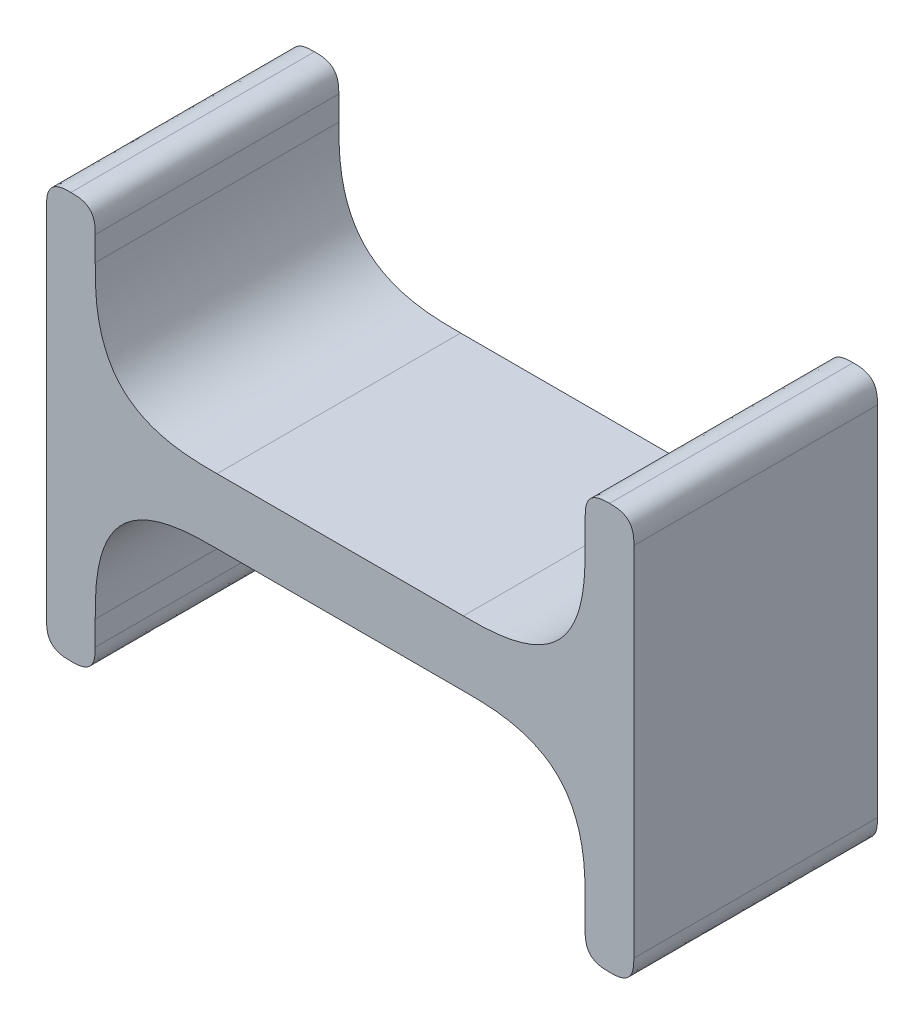
from build123d import *

# Parameters (mm, degrees)
SKETCH1_W           = 60.33
SKETCH1_H           = 4
BOSS_EXTRUDE1_DEPTH = 30
FILLET1_SIZE        = 15
FILLET2_SIZE        = 3


with BuildPart() as part:
    # Sketch1 → Boss-Extrude1 (new body)
    with BuildSketch(Plane.XY):
        Polygon((-36.165, 0), (-30.165, 0), (-30.165, 4), (-30.165, 25), (-36.165, 25), align=None)
        Polygon((-30.165, -4), (-30.165, 0), (-36.165, 0), (-36.165, -25), (-30.165, -25), align=None)
        with Locations((0, -2)):
            Rectangle(SKETCH1_W, SKETCH1_H)
        with Locations((0, 2)):
            Rectangle(SKETCH1_W, SKETCH1_H)
        Polygon((30.165, 0), (36.165, 0), (36.165, 25), (30.165, 25), (30.165, 4), align=None)
        Polygon((36.165, -25), (36.165, 0), (30.165, 0), (30.165, -4), (30.165, -25), align=None)
    extrude(amount=BOSS_EXTRUDE1_DEPTH)

    # Fillet1
    # a fillet whose section is not a circle: 15 mm, written as the material it adds along each edge
    with BuildSketch(Plane(origin=(30.165, -4, 0), x_dir=(0, -1, 0), z_dir=(0, 0, 1)), Plane(origin=(30.165, 4, 0), x_dir=(-1, 0, 0), z_dir=(0, 0, 1)), Plane(origin=(-30.165, -4, 0), x_dir=(1, 0, 0), z_dir=(0, 0, 1))) as fillet1_piece_1:
        with BuildLine():
            add(Edge.make_bspline([(FILLET1_SIZE, 0), (FILLET1_SIZE * 0.831801948466, 0), (FILLET1_SIZE * 0.663603896932, 0), (FILLET1_SIZE * 0.292893218813, -FILLET1_SIZE * 0.0716919198361), (FILLET1_SIZE * 0.0716919198361, -FILLET1_SIZE * 0.292893218813), (0, -FILLET1_SIZE * 0.663603896932), (0, -FILLET1_SIZE * 0.831801948466), (0, -FILLET1_SIZE)], knots=[0, 0, 0, 0, 0, 0, 0.5, 0.5, 1, 1, 1, 1, 1, 1], degree=5))
            Line((0, -FILLET1_SIZE), (-FILLET1_SIZE * 0.02, -FILLET1_SIZE))
            Line((-FILLET1_SIZE * 0.02, -FILLET1_SIZE), (-FILLET1_SIZE * 0.02, FILLET1_SIZE * 0.02))
            Line((-FILLET1_SIZE * 0.02, FILLET1_SIZE * 0.02), (FILLET1_SIZE, FILLET1_SIZE * 0.02))
            Line((FILLET1_SIZE, FILLET1_SIZE * 0.02), (FILLET1_SIZE, 0))
        make_face()
    extrude(amount=30)
    with BuildSketch(Plane(origin=(-30.165, 4, 0), x_dir=(1, 0, 0), z_dir=(0, 0, 1))) as fillet1_piece_2:
        with BuildLine():
            add(Edge.make_bspline([(FILLET1_SIZE, 0), (FILLET1_SIZE * 0.831801948466, 0), (FILLET1_SIZE * 0.663603896932, 0), (FILLET1_SIZE * 0.292893218813, FILLET1_SIZE * 0.0716919198361), (FILLET1_SIZE * 0.0716919198361, FILLET1_SIZE * 0.292893218813), (0, FILLET1_SIZE * 0.663603896932), (0, FILLET1_SIZE * 0.831801948466), (0, FILLET1_SIZE)], knots=[0, 0, 0, 0, 0, 0, 0.5, 0.5, 1, 1, 1, 1, 1, 1], degree=5))
            Line((0, FILLET1_SIZE), (-FILLET1_SIZE * 0.02, FILLET1_SIZE))
            Line((-FILLET1_SIZE * 0.02, FILLET1_SIZE), (-FILLET1_SIZE * 0.02, -FILLET1_SIZE * 0.02))
            Line((-FILLET1_SIZE * 0.02, -FILLET1_SIZE * 0.02), (FILLET1_SIZE, -FILLET1_SIZE * 0.02))
            Line((FILLET1_SIZE, -FILLET1_SIZE * 0.02), (FILLET1_SIZE, 0))
        make_face()
    extrude(amount=30)

    # Fillet2
    # a fillet whose section is not a circle: 3 mm, written as the material it takes off along each edge
    with BuildSketch(Plane(origin=(30.165, 25, -7.5), x_dir=(1, 0, 0), z_dir=(0, 0, 1)), Plane(origin=(36.165, 25, -7.5), x_dir=(0, -1, 0), z_dir=(0, 0, 1)), Plane(origin=(36.165, -25, -7.5), x_dir=(-1, 0, 0), z_dir=(0, 0, 1)), Plane(origin=(30.165, -25, -7.5), x_dir=(0, 1, 0), z_dir=(0, 0, 1)), Plane(origin=(-30.165, -25, -7.5), x_dir=(-1, 0, 0), z_dir=(0, 0, 1)), Plane(origin=(-36.165, -25, -7.5), x_dir=(0, 1, 0), z_dir=(0, 0, 1)), Plane(origin=(-36.165, 25, -7.5), x_dir=(1, 0, 0), z_dir=(0, 0, 1)), Plane(origin=(-30.165, 25, -7.5), x_dir=(0, -1, 0), z_dir=(0, 0, 1))) as fillet2_piece_1:
        with BuildLine():
            add(Edge.make_bspline([(FILLET2_SIZE, 0), (FILLET2_SIZE * 0.831801948466, 0), (FILLET2_SIZE * 0.663603896932, 0), (FILLET2_SIZE * 0.292893218813, -FILLET2_SIZE * 0.0716919198361), (FILLET2_SIZE * 0.0716919198361, -FILLET2_SIZE * 0.292893218813), (0, -FILLET2_SIZE * 0.663603896932), (0, -FILLET2_SIZE * 0.831801948466), (0, -FILLET2_SIZE)], knots=[0, 0, 0, 0, 0, 0, 0.5, 0.5, 1, 1, 1, 1, 1, 1], degree=5))
            Line((0, -FILLET2_SIZE), (0, 0))
            Line((0, 0), (FILLET2_SIZE, 0))
        make_face()
    extrude(amount=45, mode=Mode.SUBTRACT)


solid = part.part
